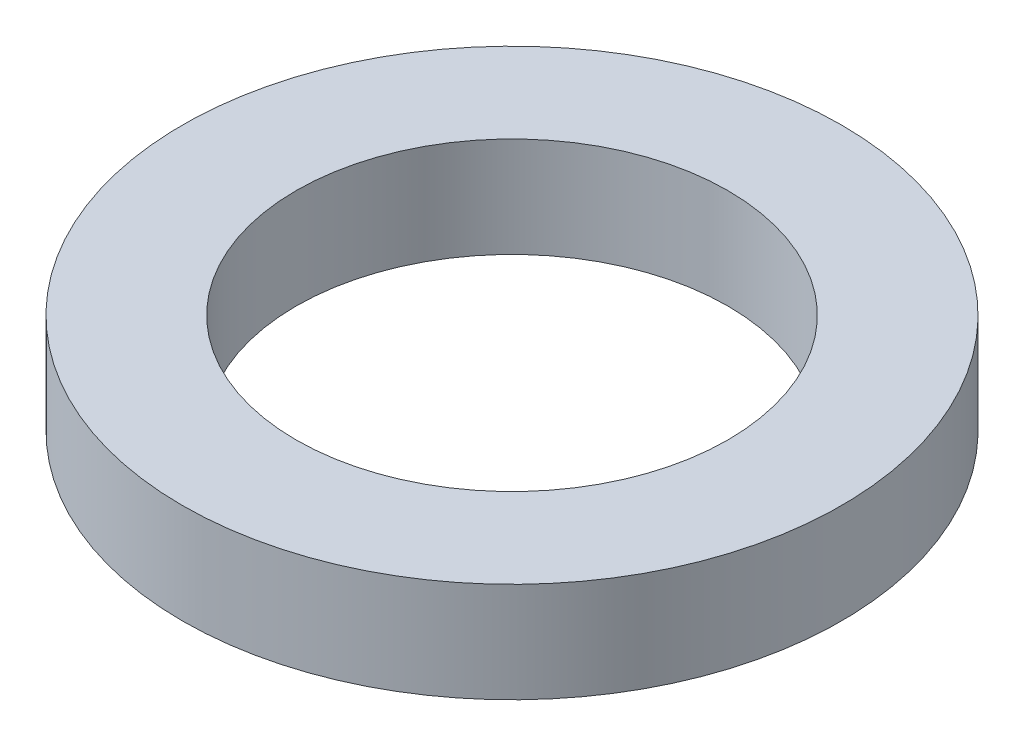
from build123d import *

# Parameters (mm, degrees)
SKETCH1_R           = 72.5
BOSS_EXTRUDE1_DEPTH = 22
SKETCH2_R           = 47.5
CUT_EXTRUDE1_DEPTH  = 105.864197894


with BuildPart() as part:
    # Sketch1 → Boss-Extrude1 (new body)
    with BuildSketch(Plane(origin=(0, 0, 0), x_dir=(1, 0, 0), z_dir=(0, 1, 0))):
        Circle(SKETCH1_R)
    extrude(amount=BOSS_EXTRUDE1_DEPTH)

    # Sketch2 → Cut-Extrude1 (cut, through all)
    with BuildSketch(Plane(origin=(0, 0, 0), x_dir=(1, 0, 0), z_dir=(0, 1, 0))):
        Circle(SKETCH2_R)
    extrude(amount=CUT_EXTRUDE1_DEPTH, mode=Mode.SUBTRACT)


solid = part.part
